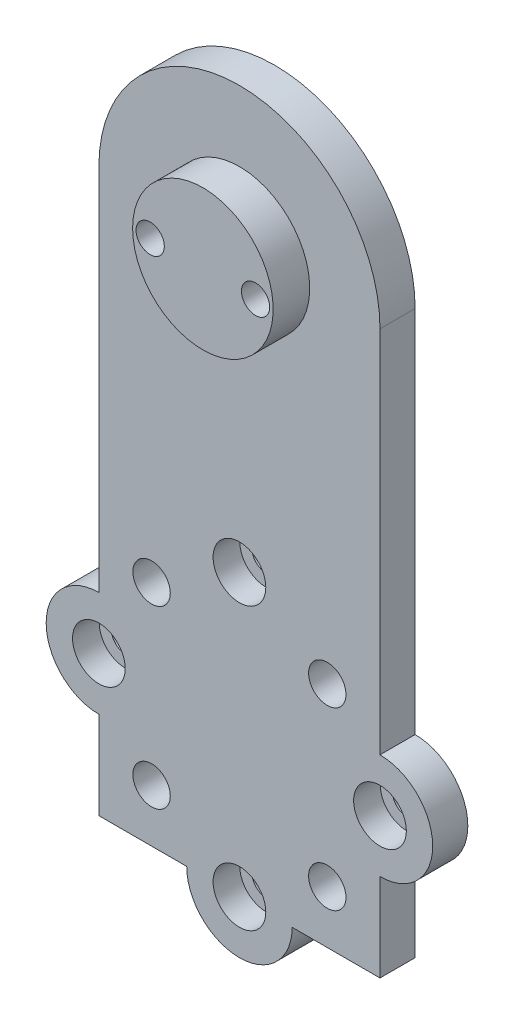
from build123d import *

# Parameters (mm, degrees)
SKETCH1_R                                       = 3.3782
BOSS_EXTRUDE1_DEPTH                             = 6.35
SKETCH2_R                                       = 12.7
BOSS_EXTRUDE2_DEPTH                             = 6.604
CBORE_FOR_10_SOCKET_HEAD_CAP_SCREW1_D           = 5.1054
CBORE_FOR_10_SOCKET_HEAD_CAP_SCREW1_CBORE_D     = 9.525
CBORE_FOR_10_SOCKET_HEAD_CAP_SCREW1_CBORE_DEPTH = 4.826
F_1_4_20_TAPPED_HOLE2_D                         = 5.1054


with BuildPart() as part:
    # Sketch1 → Boss-Extrude1 (new body)
    with BuildSketch(Plane.XY):
        with BuildLine():
            Line((0, 0), (15.875, 0))
            ThreePointArc((15.875, 0), (25.4, -9.525), (34.925, 0))
            Line((34.925, 0), (50.8, 0))
            Line((50.8, 0), (50.8, 15.875))
            ThreePointArc((50.8, 15.875), (60.325, 25.4), (50.8, 34.925))
            Line((50.8, 34.925), (50.8, 101.6))
            ThreePointArc((50.8, 101.6), (25.4, 127), (0, 101.6))
            Line((0, 101.6), (0, 34.925))
            ThreePointArc((0, 34.925), (-9.525, 25.4), (0, 15.875))
            Line((0, 15.875), (0, 0))
        make_face()
        with Locations((41.275, 9.525)):
            Circle(SKETCH1_R, mode=Mode.SUBTRACT)
        with Locations((9.525, 9.525)):
            Circle(SKETCH1_R, mode=Mode.SUBTRACT)
        with Locations((9.525, 41.275)):
            Circle(SKETCH1_R, mode=Mode.SUBTRACT)
        with Locations((41.275, 41.275)):
            Circle(SKETCH1_R, mode=Mode.SUBTRACT)
    extrude(amount=BOSS_EXTRUDE1_DEPTH)

    # Sketch2 → Boss-Extrude2 (add)
    with BuildSketch(Plane.XY.offset(6.35)):
        with Locations((25.4, 101.6)):
            Circle(SKETCH2_R)
    extrude(amount=BOSS_EXTRUDE2_DEPTH)

    # CBORE for #10 Socket Head Cap Screw1 (through all)
    with Locations(Plane.XY.offset(6.35)):
        with Locations((0, 25.4), (50.8, 25.4), (25.4, 0), (25.4, 50.8)):
            CounterBoreHole(CBORE_FOR_10_SOCKET_HEAD_CAP_SCREW1_D / 2, CBORE_FOR_10_SOCKET_HEAD_CAP_SCREW1_CBORE_D / 2, CBORE_FOR_10_SOCKET_HEAD_CAP_SCREW1_CBORE_DEPTH)

    # 1/4-20 Tapped Hole2 (through all)
    with Locations(Plane.XY.offset(12.954)):
        with Locations((15.875, 101.6), (34.925, 101.6)):
            Hole(F_1_4_20_TAPPED_HOLE2_D / 2)


solid = part.part
